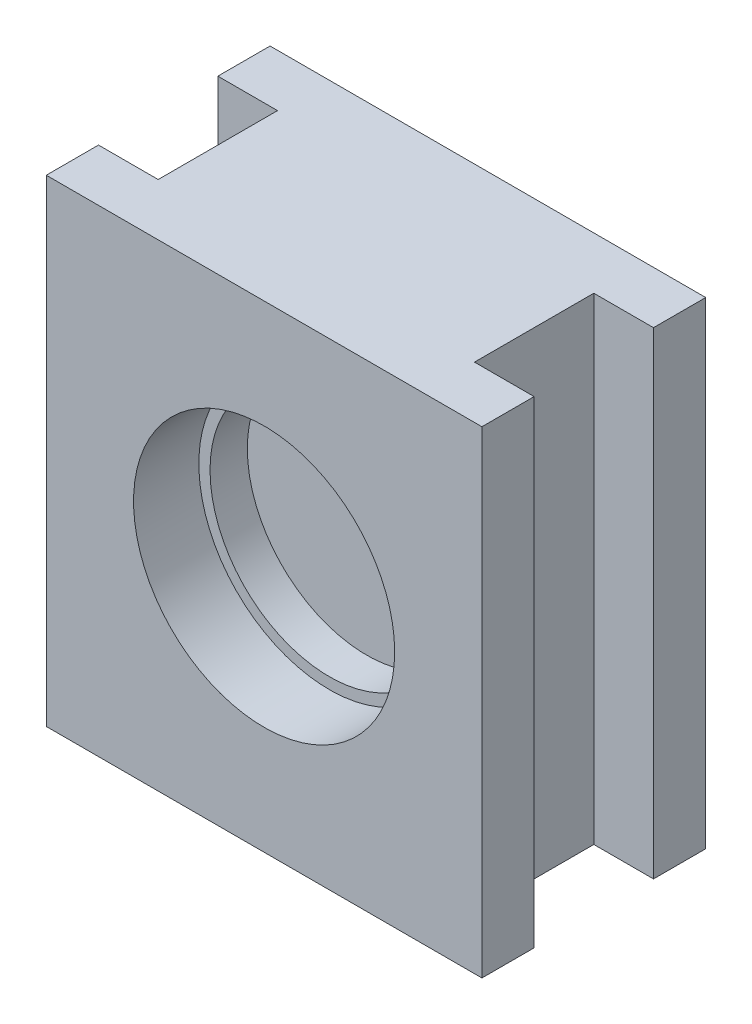
from build123d import *

# Parameters (mm, degrees)
SKETCH1_W           = 26.924
SKETCH1_H           = 40.64
BOSS_EXTRUDE1_DEPTH = 19.05
SKETCH2_W           = 4.445
SKETCH2_H           = 40.64
BOSS_EXTRUDE2_DEPTH = 5.08
SKETCH3_R           = 11.1125
CUT_EXTRUDE1_DEPTH  = 5.55625
SKETCH4_R           = 10.16
CUT_EXTRUDE2_DEPTH  = 3.175


with BuildPart() as part:
    # Sketch1 → Boss-Extrude1 (new body)
    with BuildSketch(Plane.XY):
        Rectangle(SKETCH1_W, SKETCH1_H)
    extrude(amount=BOSS_EXTRUDE1_DEPTH)

    # Sketch2 → Boss-Extrude2 (add)
    with BuildSketch(Plane(origin=(13.462, 0, 0), x_dir=(0, 0, -1), z_dir=(1, 0, 0))):
        with Locations((-16.8275, 0)):
            Rectangle(SKETCH2_W, SKETCH2_H)
        with Locations((-2.2225, 0)):
            Rectangle(SKETCH2_W, SKETCH2_H)
    boss_extrude2 = extrude(amount=BOSS_EXTRUDE2_DEPTH)

    # Mirror1: Boss-Extrude2 across plane
    add(boss_extrude2.mirror(Plane(origin=(0, 0, 0), x_dir=(0, 0, 1), z_dir=(1, 0, 0))))

    # Sketch3 → Cut-Extrude1 (cut)
    with BuildSketch(Plane.XY.offset(19.05)):
        Circle(SKETCH3_R)
    extrude(amount=-CUT_EXTRUDE1_DEPTH, mode=Mode.SUBTRACT)

    # Sketch4 → Cut-Extrude2 (cut)
    with BuildSketch(Plane.XY.offset(13.49375)):
        Circle(SKETCH4_R)
    extrude(amount=-CUT_EXTRUDE2_DEPTH, mode=Mode.SUBTRACT)


solid = part.part
